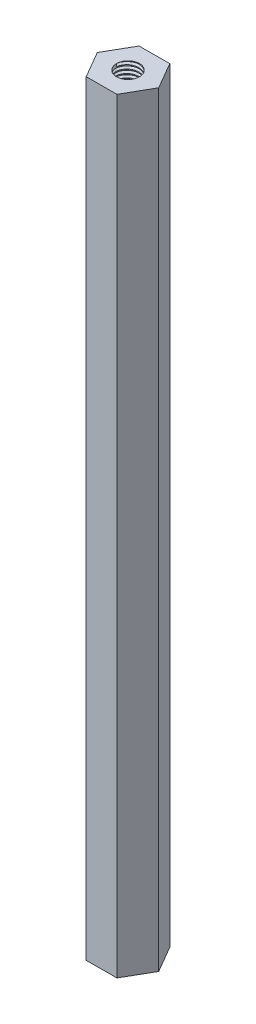
from build123d import *
from build123d.topology import SkipClean

# Parameters (mm, degrees)
EXTRUDE_1_DEPTH     = 100
SKETCH_2_R          = 1.5
CUT_EXTRUDE_1_DEPTH = 10
CUT_EXTRUDE_START   = -10
SKETCH_3_R          = 1.5
CUT_EXTRUDE_2_DEPTH = 10
THREAD_1_PITCH      = 0.5
THREAD_2_PITCH      = 0.5


with BuildPart() as part:
    # Sketch 1 → 凸台-拉伸1 (new body)
    with BuildSketch(Plane(origin=(0, 0, 0), x_dir=(1, 0, 0), z_dir=(0, 1, 0))):
        Polygon((2.009841429, -3.458419663), (4, 0.011363904), (1.990158571, 3.469783567), (-2.009841429, 3.458419663), (-4, -0.011363904), (-1.990158571, -3.469783567), align=None)
    extrude(amount=EXTRUDE_1_DEPTH)

    # Sketch 2 → 切除-拉伸1 (cut)
    with BuildSketch(Plane.XZ):
        with Locations(Location((0, 0, 0), (0, 0, 270))):
            Circle(SKETCH_2_R)
    extrude(amount=-CUT_EXTRUDE_1_DEPTH, mode=Mode.SUBTRACT)

    # 草图3 → 切除-拉伸2 (cut)
    with BuildSketch(Plane(origin=(0, 100, 0), x_dir=(1, 0, 0), z_dir=(0, 1, 0)).offset(CUT_EXTRUDE_START)):
        with Locations(Location((0, 0, 0), (0, 0, 90))):
            Circle(SKETCH_3_R)
    extrude(amount=CUT_EXTRUDE_2_DEPTH, mode=Mode.SUBTRACT)

    # 螺纹线1: the profile of Sketch 1 2 profile screwed along a right-hand helix of 16 turns, 6 arcs to a turn; built about Z, then put on its axis
    with SkipClean():  # the faces are left unmerged after this step: merging them gives an invalid solid
        thread_1_z = Axis((0, 0, 0), (0, 0, 1))
        thread_1_corners = [(1.4997, 0, -0.000173205), (1.770632938, 0, 0.156249999), (1.770632938, 0, 0.218749999), (1.4997, 0, 0.375173204)]
        with BuildLine(mode=Mode.PRIVATE) as thread_1_profile:
            Line(thread_1_corners[0], thread_1_corners[1])
            Line(thread_1_corners[1], thread_1_corners[2])
            Line(thread_1_corners[2], thread_1_corners[3])
            Line(thread_1_corners[3], thread_1_corners[0])
        thread_1_cap = Face(thread_1_profile.wire())
        thread_1_turn_angles = [0, 30, 60, 90, 120, 150, 180, 210, 240, 270, 300, 330, 360]
        thread_1_turn_weights = [1, 0.8660254037844387, 1, 0.8660254037844387, 1, 0.8660254037844387, 1, 0.8660254037844387, 1, 0.8660254037844387, 1, 0.8660254037844387, 1]
        thread_1_turn_rails = [Edge.make_bspline([Vector(p[0], p[1], 0).rotate(thread_1_z, thread_1_turn_angles[k]) / thread_1_turn_weights[k] + Vector(0, 0, p[2] + THREAD_1_PITCH * thread_1_turn_angles[k] / 360) for k in range(13)], [0, 0, 0, 1, 1, 2, 2, 3, 3, 4, 4, 5, 5, 6, 6, 6], 2, thread_1_turn_weights) for p in thread_1_corners]
        thread_1_turn_sides = [Face.make_surface_from_curves(thread_1_turn_rails[p[0]], thread_1_turn_rails[p[1]]) for p in [(0, 1), (1, 2), (2, 3), (3, 0)]]
        thread_1 = Plane(origin=(0, 0, 0), x_dir=(1, 0, 0), z_dir=(0, 1, 0)) * Solid(Shell([*[p.moved(Location((0, 0, THREAD_1_PITCH * i))) for i in range(16) for p in thread_1_turn_sides], thread_1_cap, thread_1_cap.rotate(thread_1_z, 5760).moved(Location((0, 0, THREAD_1_PITCH * 5760 / 360)))]))
        add(thread_1, mode=Mode.SUBTRACT)

    # 螺纹线2: the profile of Sketch 2 2 profile screwed along a right-hand helix of 16 turns, 6 arcs to a turn; built about Z, then put on its axis
    with SkipClean():  # the faces are left unmerged after this step: merging them gives an invalid solid
        thread_2_z = Axis((0, 0, 0), (0, 0, 1))
        thread_2_corners = [(1.4997, 0, -0.000173205), (1.770632938, 0, 0.156249999), (1.770632938, 0, 0.218749999), (1.4997, 0, 0.375173204)]
        with BuildLine(mode=Mode.PRIVATE) as thread_2_profile:
            Line(thread_2_corners[0], thread_2_corners[1])
            Line(thread_2_corners[1], thread_2_corners[2])
            Line(thread_2_corners[2], thread_2_corners[3])
            Line(thread_2_corners[3], thread_2_corners[0])
        thread_2_cap = Face(thread_2_profile.wire())
        thread_2_turn_angles = [0, 30, 60, 90, 120, 150, 180, 210, 240, 270, 300, 330, 360]
        thread_2_turn_weights = [1, 0.8660254037844387, 1, 0.8660254037844387, 1, 0.8660254037844387, 1, 0.8660254037844387, 1, 0.8660254037844387, 1, 0.8660254037844387, 1]
        thread_2_turn_rails = [Edge.make_bspline([Vector(p[0], p[1], 0).rotate(thread_2_z, thread_2_turn_angles[k]) / thread_2_turn_weights[k] + Vector(0, 0, p[2] + THREAD_2_PITCH * thread_2_turn_angles[k] / 360) for k in range(13)], [0, 0, 0, 1, 1, 2, 2, 3, 3, 4, 4, 5, 5, 6, 6, 6], 2, thread_2_turn_weights) for p in thread_2_corners]
        thread_2_turn_sides = [Face.make_surface_from_curves(thread_2_turn_rails[p[0]], thread_2_turn_rails[p[1]]) for p in [(0, 1), (1, 2), (2, 3), (3, 0)]]
        thread_2 = Plane(origin=(0, 100, 0), x_dir=(-1, 0, 0), z_dir=(0, -1, 0)) * Solid(Shell([*[p.moved(Location((0, 0, THREAD_2_PITCH * i))) for i in range(16) for p in thread_2_turn_sides], thread_2_cap, thread_2_cap.rotate(thread_2_z, 5760).moved(Location((0, 0, THREAD_2_PITCH * 5760 / 360)))]))
        add(thread_2, mode=Mode.SUBTRACT)


solid = part.part
